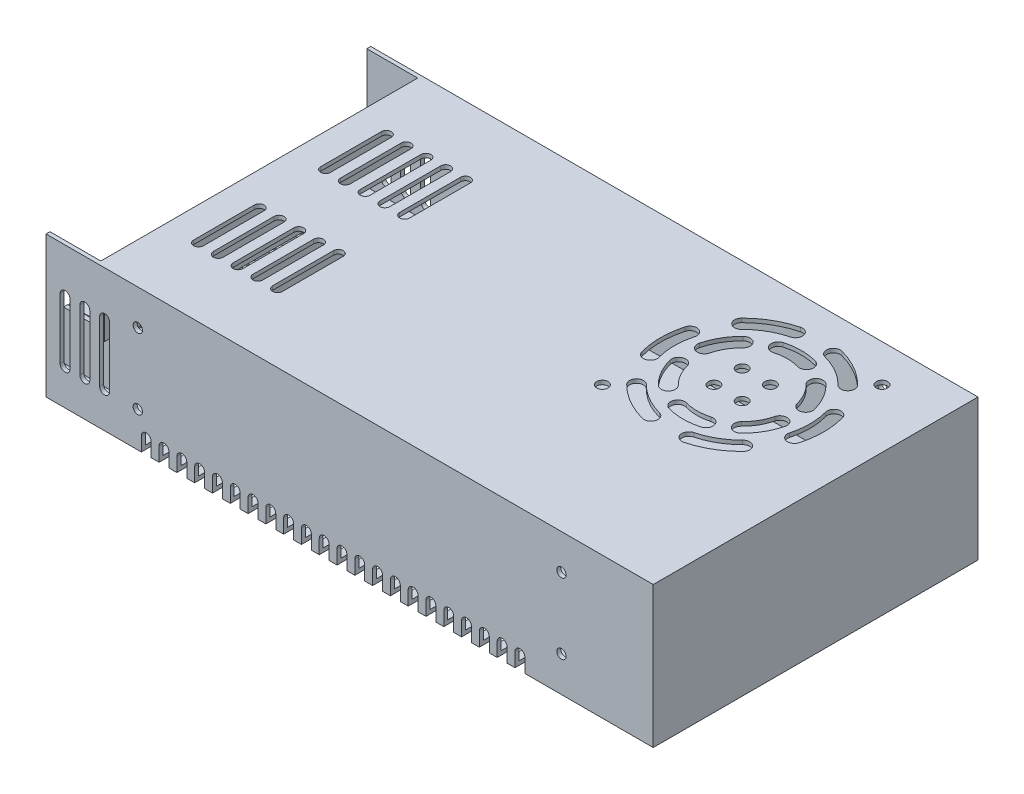
from build123d import *

# Parameters (mm, degrees)
BOSS_EXTRUDE1_DEPTH                  = 50
SKETCH2_W                            = 215
SKETCH2_H                            = 115
BOSS_EXTRUDE2_DEPTH                  = 1.4
SKETCH3_W                            = 197
SKETCH3_H                            = 115
BOSS_EXTRUDE3_DEPTH                  = 1.4
SKETCH4_W                            = 1.4
SKETCH4_H                            = 112.2
BOSS_EXTRUDE4_DEPTH                  = 24
SKETCH16_W                           = 1.4
SKETCH16_H                           = 112.2
BOSS_EXTRUDE5_DEPTH                  = 6
CUT_EXTRUDE1_DEPTH                   = 1.4
CUT_EXTRUDE2_DEPTH                   = 1.4
CUT_EXTRUDE3_START                   = -1.4
CUT_EXTRUDE3_DEPTH                   = 1.4
CUT_EXTRUDE4_DEPTH                   = 1.4
SKETCH15_R                           = 2
CUT_EXTRUDE5_DEPTH                   = 1.4
SKETCH17_W                           = 213.5
SKETCH17_H                           = 112
BOSS_EXTRUDE6_DEPTH                  = 1.6
TAP_START                            = -57.5
TAP_DRILL_FOR_M4X0_7_TAP3_OUTLINE_R  = 1.65
TAP_DRILL_FOR_M4X0_7_TAP3_DEPTH      = 1.4
TAP_START_2                          = 56.1
TAP_DRILL_FOR_M4X0_7_TAP2_OUTLINE_R  = 1.65
TAP_DRILL_FOR_M4X0_7_TAP2_DEPTH      = 1.4
SKETCH20_W                           = 1.25
SKETCH20_H                           = 1.4
TAP_DRILL_FOR_M3X0_5_TAP3_AT_2_COUNT = 2
TAP_DRILL_FOR_M3X0_5_TAP3_AT_2_PITCH = 95
TAP_DRILL_FOR_M3X0_5_TAP3_AT_3_COUNT = 2
TAP_DRILL_FOR_M3X0_5_TAP3_AT_3_PITCH = 177.5
TAP_DRILL_FOR_M3X0_5_TAP3_AT_4_COUNT = 2
TAP_DRILL_FOR_M3X0_5_TAP3_AT_4_PITCH = 201.323744253
SKETCH21_W                           = 1.65
SKETCH21_H                           = 7.7
TAP_DRILL_FOR_M4X0_7_TAP1_AT_2_COUNT = 2
TAP_DRILL_FOR_M4X0_7_TAP1_AT_2_PITCH = 50
TAP_DRILL_FOR_M4X0_7_TAP1_AT_3_COUNT = 2
TAP_DRILL_FOR_M4X0_7_TAP1_AT_3_PITCH = 150
TAP_DRILL_FOR_M4X0_7_TAP1_AT_4_COUNT = 2
TAP_DRILL_FOR_M4X0_7_TAP1_AT_4_PITCH = 158.113883008
SKETCH22_W                           = 17.5
SKETCH22_H                           = 87.3
BOSS_EXTRUDE7_DEPTH                  = 7
BOSS_EXTRUDE8_DEPTH                  = 13.2
BOSS_EXTRUDE9_DEPTH                  = 17.2
SKETCH23_W                           = 7.633333334
SKETCH23_H                           = 7.633333333
SKETCH23_H_2                         = 7.633333334
BOSS_EXTRUDE10_DEPTH                 = 1.2
SKETCH23_3_R                         = 3.25
BOSS_EXTRUDE11_DEPTH                 = 4
FILLET1_R                            = 1
CUT_EXTRUDE7_START                   = 3
CUT_EXTRUDE7_DEPTH                   = 1
SKETCH24_W                           = 17.3
SKETCH24_H                           = 83.9
BOSS_EXTRUDE12_DEPTH                 = 2
SKETCH25_W                           = 1.9
SKETCH25_H                           = 0.25
SKETCH25_W_2                         = 2.7
SKETCH25_W_3                         = 0.4
SKETCH25_H_2                         = 8.5
BOSS_EXTRUDE13_DEPTH                 = 0.01


# Read off the part's stored shape, not the designer's step: Tap Drill for M4x0.7 Tap3, Tap Drill for M4x0.7 Tap2
with BuildPart() as part:
    # Sketch1 → Boss-Extrude1 (new body)
    with BuildSketch(Plane(origin=(0, 0, 0), x_dir=(1, 0, 0), z_dir=(0, 1, 0))):
        Polygon((-107.5, 56.1), (106.1, 56.1), (106.1, -56.1), (-107.5, -56.1), (-107.5, -57.5), (107.5, -57.5), (107.5, 57.5), (-107.5, 57.5), align=None)
    extrude(amount=BOSS_EXTRUDE1_DEPTH)

    # Sketch2 → Boss-Extrude2 (add)
    with BuildSketch(Plane(origin=(0, 0, 0), x_dir=(1, 0, 0), z_dir=(0, 1, 0))):
        Rectangle(SKETCH2_W, SKETCH2_H)
    extrude(amount=BOSS_EXTRUDE2_DEPTH)

    # Sketch3 → Boss-Extrude3 (add)
    with BuildSketch(Plane(origin=(0, 50, 0), x_dir=(1, 0, 0), z_dir=(0, 1, 0))):
        with Locations((9, 0)):
            Rectangle(SKETCH3_W, SKETCH3_H)
    extrude(amount=-BOSS_EXTRUDE3_DEPTH)

    # Sketch4 → Boss-Extrude4 (add)
    with BuildSketch(Plane(origin=(0, 50, 0), x_dir=(1, 0, 0), z_dir=(0, 1, 0))):
        with Locations((-88.8, 0)):
            Rectangle(SKETCH4_W, SKETCH4_H)
    extrude(amount=-BOSS_EXTRUDE4_DEPTH)

    # Sketch16 → Boss-Extrude5 (add)
    with BuildSketch(Plane.XZ):
        with Locations((-106.8, 0)):
            Rectangle(SKETCH16_W, SKETCH16_H)
    extrude(amount=-BOSS_EXTRUDE5_DEPTH)

    # Sketch5 → Cut-Extrude1 (cut)
    with BuildSketch(Plane(origin=(0, 50, 0), x_dir=(1, 0, 0), z_dir=(0, 1, 0))):
        with BuildLine():
            Line((-79.5, -11.75), (-79.5, -33.25))
            ThreePointArc((-79.5, -33.25), (-77.75, -35), (-76, -33.25))
            Line((-76, -33.25), (-76, -11.75))
            ThreePointArc((-76, -11.75), (-77.75, -10), (-79.5, -11.75))
        make_face()
        with BuildLine():
            Line((-72.5, -11.75), (-72.5, -33.25))
            ThreePointArc((-72.5, -33.25), (-70.75, -35), (-69, -33.25))
            Line((-69, -33.25), (-69, -11.75))
            ThreePointArc((-69, -11.75), (-70.75, -10), (-72.5, -11.75))
        make_face()
        with BuildLine():
            Line((-65.5, -11.75), (-65.5, -33.25))
            ThreePointArc((-65.5, -33.25), (-63.75, -35), (-62, -33.25))
            Line((-62, -33.25), (-62, -11.75))
            ThreePointArc((-62, -11.75), (-63.75, -10), (-65.5, -11.75))
        make_face()
        with BuildLine():
            Line((-58.5, -11.75), (-58.5, -33.25))
            ThreePointArc((-58.5, -33.25), (-56.75, -35), (-55, -33.25))
            Line((-55, -33.25), (-55, -11.75))
            ThreePointArc((-55, -11.75), (-56.75, -10), (-58.5, -11.75))
        make_face()
        with BuildLine():
            Line((-51.5, -11.75), (-51.5, -33.25))
            ThreePointArc((-51.5, -33.25), (-49.75, -35), (-48, -33.25))
            Line((-48, -33.25), (-48, -11.75))
            ThreePointArc((-48, -11.75), (-49.75, -10), (-51.5, -11.75))
        make_face()
        with BuildLine():
            Line((-48, 33.25), (-48, 11.75))
            ThreePointArc((-48, 11.75), (-49.75, 10), (-51.5, 11.75))
            Line((-51.5, 11.75), (-51.5, 33.25))
            ThreePointArc((-51.5, 33.25), (-49.75, 35), (-48, 33.25))
        make_face()
        with BuildLine():
            Line((-55, 33.25), (-55, 11.75))
            ThreePointArc((-55, 11.75), (-56.75, 10), (-58.5, 11.75))
            Line((-58.5, 11.75), (-58.5, 33.25))
            ThreePointArc((-58.5, 33.25), (-56.75, 35), (-55, 33.25))
        make_face()
        with BuildLine():
            Line((-62, 33.25), (-62, 11.75))
            ThreePointArc((-62, 11.75), (-63.75, 10), (-65.5, 11.75))
            Line((-65.5, 11.75), (-65.5, 33.25))
            ThreePointArc((-65.5, 33.25), (-63.75, 35), (-62, 33.25))
        make_face()
        with BuildLine():
            Line((-69, 33.25), (-69, 11.75))
            ThreePointArc((-69, 11.75), (-70.75, 10), (-72.5, 11.75))
            Line((-72.5, 11.75), (-72.5, 33.25))
            ThreePointArc((-72.5, 33.25), (-70.75, 35), (-69, 33.25))
        make_face()
        with BuildLine():
            Line((-76, 33.25), (-76, 11.75))
            ThreePointArc((-76, 11.75), (-77.75, 10), (-79.5, 11.75))
            Line((-79.5, 11.75), (-79.5, 33.25))
            ThreePointArc((-79.5, 33.25), (-77.75, 35), (-76, 33.25))
        make_face()
    extrude(amount=-CUT_EXTRUDE1_DEPTH, mode=Mode.SUBTRACT)

    # Sketch6 → Cut-Extrude2 (cut)
    with BuildSketch(Plane(origin=(0, 0, -57.5), x_dir=(-1, 0, 0), z_dir=(0, 0, -1))):
        with BuildLine():
            Line((102.5, 34.25), (102.5, 12.75))
            ThreePointArc((102.5, 12.75), (100.75, 11), (99, 12.75))
            Line((99, 12.75), (99, 34.25))
            ThreePointArc((99, 34.25), (100.75, 36), (102.5, 34.25))
        make_face()
        with BuildLine():
            Line((92, 34.25), (92, 12.75))
            ThreePointArc((92, 12.75), (93.75, 11), (95.5, 12.75))
            Line((95.5, 12.75), (95.5, 34.25))
            ThreePointArc((95.5, 34.25), (93.75, 36), (92, 34.25))
        make_face()
        with BuildLine():
            Line((85, 34.25), (85, 12.75))
            ThreePointArc((85, 12.75), (86.75, 11), (88.5, 12.75))
            Line((88.5, 12.75), (88.5, 34.25))
            ThreePointArc((88.5, 34.25), (86.75, 36), (85, 34.25))
        make_face()
        with BuildLine():
            Line((73.75, 5), (73.75, 0))
            Line((73.75, 0), (70.25, 0))
            Line((70.25, 0), (70.25, 5))
            ThreePointArc((70.25, 5), (72, 6.75), (73.75, 5))
        make_face()
        with BuildLine():
            Line((67.45, 5), (67.45, 0))
            Line((67.45, 0), (63.95, 0))
            Line((63.95, 0), (63.95, 5))
            ThreePointArc((63.95, 5), (65.7, 6.75), (67.45, 5))
        make_face()
        with BuildLine():
            Line((61.15, 5), (61.15, 0))
            Line((61.15, 0), (57.65, 0))
            Line((57.65, 0), (57.65, 5))
            ThreePointArc((57.65, 5), (59.4, 6.75), (61.15, 5))
        make_face()
        with BuildLine():
            Line((54.85, 5), (54.85, 0))
            Line((54.85, 0), (51.35, 0))
            Line((51.35, 0), (51.35, 5))
            ThreePointArc((51.35, 5), (53.1, 6.75), (54.85, 5))
        make_face()
        with BuildLine():
            Line((48.55, 5), (48.55, 0))
            Line((48.55, 0), (45.05, 0))
            Line((45.05, 0), (45.05, 5))
            ThreePointArc((45.05, 5), (46.8, 6.75), (48.55, 5))
        make_face()
        with BuildLine():
            Line((42.25, 5), (42.25, 0))
            Line((42.25, 0), (38.75, 0))
            Line((38.75, 0), (38.75, 5))
            ThreePointArc((38.75, 5), (40.5, 6.75), (42.25, 5))
        make_face()
        with BuildLine():
            Line((35.95, 5), (35.95, 0))
            Line((35.95, 0), (32.45, 0))
            Line((32.45, 0), (32.45, 5))
            ThreePointArc((32.45, 5), (34.2, 6.75), (35.95, 5))
        make_face()
        with BuildLine():
            Line((29.65, 5), (29.65, 0))
            Line((29.65, 0), (26.15, 0))
            Line((26.15, 0), (26.15, 5))
            ThreePointArc((26.15, 5), (27.9, 6.75), (29.65, 5))
        make_face()
        with BuildLine():
            Line((23.35, 5), (23.35, 0))
            Line((23.35, 0), (19.85, 0))
            Line((19.85, 0), (19.85, 5))
            ThreePointArc((19.85, 5), (21.6, 6.75), (23.35, 5))
        make_face()
        with BuildLine():
            Line((17.05, 5), (17.05, 0))
            Line((17.05, 0), (13.55, 0))
            Line((13.55, 0), (13.55, 5))
            ThreePointArc((13.55, 5), (15.3, 6.75), (17.05, 5))
        make_face()
        with BuildLine():
            Line((10.75, 5), (10.75, 0))
            Line((10.75, 0), (7.25, 0))
            Line((7.25, 0), (7.25, 5))
            ThreePointArc((7.25, 5), (9, 6.75), (10.75, 5))
        make_face()
        with BuildLine():
            Line((4.45, 5), (4.45, 0))
            Line((4.45, 0), (0.95, 0))
            Line((0.95, 0), (0.95, 5))
            ThreePointArc((0.95, 5), (2.7, 6.75), (4.45, 5))
        make_face()
        with BuildLine():
            Line((-1.85, 5), (-1.85, 0))
            Line((-1.85, 0), (-5.35, 0))
            Line((-5.35, 0), (-5.35, 5))
            ThreePointArc((-5.35, 5), (-3.6, 6.75), (-1.85, 5))
        make_face()
        with BuildLine():
            Line((-8.15, 5), (-8.15, 0))
            Line((-8.15, 0), (-11.65, 0))
            Line((-11.65, 0), (-11.65, 5))
            ThreePointArc((-11.65, 5), (-9.9, 6.75), (-8.15, 5))
        make_face()
        with BuildLine():
            Line((-14.45, 5), (-14.45, 0))
            Line((-14.45, 0), (-17.95, 0))
            Line((-17.95, 0), (-17.95, 5))
            ThreePointArc((-17.95, 5), (-16.2, 6.75), (-14.45, 5))
        make_face()
        with BuildLine():
            Line((-20.75, 5), (-20.75, 0))
            Line((-20.75, 0), (-24.25, 0))
            Line((-24.25, 0), (-24.25, 5))
            ThreePointArc((-24.25, 5), (-22.5, 6.75), (-20.75, 5))
        make_face()
        with BuildLine():
            Line((-27.05, 5), (-27.05, 0))
            Line((-27.05, 0), (-30.55, 0))
            Line((-30.55, 0), (-30.55, 5))
            ThreePointArc((-30.55, 5), (-28.8, 6.75), (-27.05, 5))
        make_face()
        with BuildLine():
            Line((-33.35, 5), (-33.35, 0))
            Line((-33.35, 0), (-36.85, 0))
            Line((-36.85, 0), (-36.85, 5))
            ThreePointArc((-36.85, 5), (-35.1, 6.75), (-33.35, 5))
        make_face()
        with BuildLine():
            Line((-39.65, 5), (-39.65, 0))
            Line((-39.65, 0), (-43.15, 0))
            Line((-43.15, 0), (-43.15, 5))
            ThreePointArc((-43.15, 5), (-41.4, 6.75), (-39.65, 5))
        make_face()
        with BuildLine():
            Line((-45.95, 5), (-45.95, 0))
            Line((-45.95, 0), (-49.45, 0))
            Line((-49.45, 0), (-49.45, 5))
            ThreePointArc((-49.45, 5), (-47.7, 6.75), (-45.95, 5))
        make_face()
        with BuildLine():
            Line((-52.25, 5), (-52.25, 0))
            Line((-52.25, 0), (-55.75, 0))
            Line((-55.75, 0), (-55.75, 5))
            ThreePointArc((-55.75, 5), (-54, 6.75), (-52.25, 5))
        make_face()
        with BuildLine():
            Line((-58.55, 5), (-58.55, 0))
            Line((-58.55, 0), (-62.05, 0))
            Line((-62.05, 0), (-62.05, 5))
            ThreePointArc((-62.05, 5), (-60.3, 6.75), (-58.55, 5))
        make_face()
    extrude(amount=-CUT_EXTRUDE2_DEPTH, mode=Mode.SUBTRACT)

    # Sketch7 → Cut-Extrude3 (cut)
    with BuildSketch(Plane.XY.offset(57.5).offset(CUT_EXTRUDE3_START)):
        with BuildLine():
            Line((-102.5, 34.25), (-102.5, 12.75))
            ThreePointArc((-102.5, 12.75), (-100.75, 11), (-99, 12.75))
            Line((-99, 12.75), (-99, 34.25))
            ThreePointArc((-99, 34.25), (-100.75, 36), (-102.5, 34.25))
        make_face()
        with BuildLine():
            Line((-73.75, 5), (-73.75, 0))
            Line((-73.75, 0), (-70.25, 0))
            Line((-70.25, 0), (-70.25, 5))
            ThreePointArc((-70.25, 5), (-72, 6.75), (-73.75, 5))
        make_face()
        with BuildLine():
            Line((-85, 12.75), (-85, 34.25))
            ThreePointArc((-85, 34.25), (-86.75, 36), (-88.5, 34.25))
            Line((-88.5, 34.25), (-88.5, 12.75))
            ThreePointArc((-88.5, 12.75), (-86.75, 11), (-85, 12.75))
        make_face()
        with BuildLine():
            Line((-92, 12.75), (-92, 34.25))
            ThreePointArc((-92, 34.25), (-93.75, 36), (-95.5, 34.25))
            Line((-95.5, 34.25), (-95.5, 12.75))
            ThreePointArc((-95.5, 12.75), (-93.75, 11), (-92, 12.75))
        make_face()
        with BuildLine():
            Line((-54.85, 5), (-54.85, 0))
            Line((-54.85, 0), (-51.35, 0))
            Line((-51.35, 0), (-51.35, 5))
            ThreePointArc((-51.35, 5), (-53.1, 6.75), (-54.85, 5))
        make_face()
        with BuildLine():
            Line((-61.15, 5), (-61.15, 0))
            Line((-61.15, 0), (-57.65, 0))
            Line((-57.65, 0), (-57.65, 5))
            ThreePointArc((-57.65, 5), (-59.4, 6.75), (-61.15, 5))
        make_face()
        with BuildLine():
            Line((-63.95, 0), (-63.95, 5))
            ThreePointArc((-63.95, 5), (-65.7, 6.75), (-67.45, 5))
            Line((-67.45, 5), (-67.45, 0))
            Line((-67.45, 0), (-63.95, 0))
        make_face()
        with BuildLine():
            Line((-29.65, 5), (-29.65, 0))
            Line((-29.65, 0), (-26.15, 0))
            Line((-26.15, 0), (-26.15, 5))
            ThreePointArc((-26.15, 5), (-27.9, 6.75), (-29.65, 5))
        make_face()
        with BuildLine():
            Line((-35.95, 5), (-35.95, 0))
            Line((-35.95, 0), (-32.45, 0))
            Line((-32.45, 0), (-32.45, 5))
            ThreePointArc((-32.45, 5), (-34.2, 6.75), (-35.95, 5))
        make_face()
        with BuildLine():
            Line((-42.25, 5), (-42.25, 0))
            Line((-42.25, 0), (-38.75, 0))
            Line((-38.75, 0), (-38.75, 5))
            ThreePointArc((-38.75, 5), (-40.5, 6.75), (-42.25, 5))
        make_face()
        with BuildLine():
            Line((-45.05, 0), (-45.05, 5))
            ThreePointArc((-45.05, 5), (-46.8, 6.75), (-48.55, 5))
            Line((-48.55, 5), (-48.55, 0))
            Line((-48.55, 0), (-45.05, 0))
        make_face()
        with BuildLine():
            Line((-10.75, 5), (-10.75, 0))
            Line((-10.75, 0), (-7.25, 0))
            Line((-7.25, 0), (-7.25, 5))
            ThreePointArc((-7.25, 5), (-9, 6.75), (-10.75, 5))
        make_face()
        with BuildLine():
            Line((-17.05, 5), (-17.05, 0))
            Line((-17.05, 0), (-13.55, 0))
            Line((-13.55, 0), (-13.55, 5))
            ThreePointArc((-13.55, 5), (-15.3, 6.75), (-17.05, 5))
        make_face()
        with BuildLine():
            Line((-23.35, 5), (-23.35, 0))
            Line((-23.35, 0), (-19.85, 0))
            Line((-19.85, 0), (-19.85, 5))
            ThreePointArc((-19.85, 5), (-21.6, 6.75), (-23.35, 5))
        make_face()
        with BuildLine():
            Line((8.15, 5), (8.15, 0))
            Line((8.15, 0), (11.65, 0))
            Line((11.65, 0), (11.65, 5))
            ThreePointArc((11.65, 5), (9.9, 6.75), (8.15, 5))
        make_face()
        with BuildLine():
            Line((1.85, 5), (1.85, 0))
            Line((1.85, 0), (5.35, 0))
            Line((5.35, 0), (5.35, 5))
            ThreePointArc((5.35, 5), (3.6, 6.75), (1.85, 5))
        make_face()
        with BuildLine():
            Line((-4.45, 5), (-4.45, 0))
            Line((-4.45, 0), (-0.95, 0))
            Line((-0.95, 0), (-0.95, 5))
            ThreePointArc((-0.95, 5), (-2.7, 6.75), (-4.45, 5))
        make_face()
        with BuildLine():
            Line((27.05, 5), (27.05, 0))
            Line((27.05, 0), (30.55, 0))
            Line((30.55, 0), (30.55, 5))
            ThreePointArc((30.55, 5), (28.8, 6.75), (27.05, 5))
        make_face()
        with BuildLine():
            Line((20.75, 5), (20.75, 0))
            Line((20.75, 0), (24.25, 0))
            Line((24.25, 0), (24.25, 5))
            ThreePointArc((24.25, 5), (22.5, 6.75), (20.75, 5))
        make_face()
        with BuildLine():
            Line((14.45, 5), (14.45, 0))
            Line((14.45, 0), (17.95, 0))
            Line((17.95, 0), (17.95, 5))
            ThreePointArc((17.95, 5), (16.2, 6.75), (14.45, 5))
        make_face()
        with BuildLine():
            Line((45.95, 5), (45.95, 0))
            Line((45.95, 0), (49.45, 0))
            Line((49.45, 0), (49.45, 5))
            ThreePointArc((49.45, 5), (47.7, 6.75), (45.95, 5))
        make_face()
        with BuildLine():
            Line((39.65, 5), (39.65, 0))
            Line((39.65, 0), (43.15, 0))
            Line((43.15, 0), (43.15, 5))
            ThreePointArc((43.15, 5), (41.4, 6.75), (39.65, 5))
        make_face()
        with BuildLine():
            Line((36.85, 0), (36.85, 5))
            ThreePointArc((36.85, 5), (35.1, 6.75), (33.35, 5))
            Line((33.35, 5), (33.35, 0))
            Line((33.35, 0), (36.85, 0))
        make_face()
        with BuildLine():
            Line((58.55, 5), (58.55, 0))
            Line((58.55, 0), (62.05, 0))
            Line((62.05, 0), (62.05, 5))
            ThreePointArc((62.05, 5), (60.3, 6.75), (58.55, 5))
        make_face()
        with BuildLine():
            Line((55.75, 0), (55.75, 5))
            ThreePointArc((55.75, 5), (54, 6.75), (52.25, 5))
            Line((52.25, 5), (52.25, 0))
            Line((52.25, 0), (55.75, 0))
        make_face()
    extrude(amount=CUT_EXTRUDE3_DEPTH, mode=Mode.SUBTRACT)

    # Sketch14 → Cut-Extrude4 (cut)
    with BuildSketch(Plane.XZ):
        with BuildLine():
            Line((-73.75, -56.1), (-73.75, -37.85))
            ThreePointArc((-73.75, -37.85), (-72, -36.1), (-70.25, -37.85))
            Line((-70.25, -37.85), (-70.25, -56.1))
            Line((-70.25, -56.1), (-73.75, -56.1))
        make_face()
        with BuildLine():
            Line((-67.45, -56.1), (-67.45, -37.85))
            ThreePointArc((-67.45, -37.85), (-65.7, -36.1), (-63.95, -37.85))
            Line((-63.95, -37.85), (-63.95, -56.1))
            Line((-63.95, -56.1), (-67.45, -56.1))
        make_face()
        with BuildLine():
            Line((-61.15, -56.1), (-61.15, -37.85))
            ThreePointArc((-61.15, -37.85), (-59.4, -36.1), (-57.65, -37.85))
            Line((-57.65, -37.85), (-57.65, -56.1))
            Line((-57.65, -56.1), (-61.15, -56.1))
        make_face()
        with BuildLine():
            Line((-54.85, -56.1), (-54.85, -37.85))
            ThreePointArc((-54.85, -37.85), (-53.1, -36.1), (-51.35, -37.85))
            Line((-51.35, -37.85), (-51.35, -56.1))
            Line((-51.35, -56.1), (-54.85, -56.1))
        make_face()
        with BuildLine():
            Line((-48.55, -56.1), (-48.55, -37.85))
            ThreePointArc((-48.55, -37.85), (-46.8, -36.1), (-45.05, -37.85))
            Line((-45.05, -37.85), (-45.05, -56.1))
            Line((-45.05, -56.1), (-48.55, -56.1))
        make_face()
        with BuildLine():
            Line((-42.25, -56.1), (-42.25, -37.85))
            ThreePointArc((-42.25, -37.85), (-40.5, -36.1), (-38.75, -37.85))
            Line((-38.75, -37.85), (-38.75, -56.1))
            Line((-38.75, -56.1), (-42.25, -56.1))
        make_face()
        with BuildLine():
            Line((-35.95, -56.1), (-35.95, -37.85))
            ThreePointArc((-35.95, -37.85), (-34.2, -36.1), (-32.45, -37.85))
            Line((-32.45, -37.85), (-32.45, -56.1))
            Line((-32.45, -56.1), (-35.95, -56.1))
        make_face()
        with BuildLine():
            Line((-29.65, -56.1), (-29.65, -37.85))
            ThreePointArc((-29.65, -37.85), (-27.9, -36.1), (-26.15, -37.85))
            Line((-26.15, -37.85), (-26.15, -56.1))
            Line((-26.15, -56.1), (-29.65, -56.1))
        make_face()
        with BuildLine():
            Line((-23.35, -56.1), (-23.35, -37.85))
            ThreePointArc((-23.35, -37.85), (-21.6, -36.1), (-19.85, -37.85))
            Line((-19.85, -37.85), (-19.85, -56.1))
            Line((-19.85, -56.1), (-23.35, -56.1))
        make_face()
        with BuildLine():
            Line((-17.05, -56.1), (-17.05, -37.85))
            ThreePointArc((-17.05, -37.85), (-15.3, -36.1), (-13.55, -37.85))
            Line((-13.55, -37.85), (-13.55, -56.1))
            Line((-13.55, -56.1), (-17.05, -56.1))
        make_face()
        with BuildLine():
            Line((-10.75, -56.1), (-10.75, -37.85))
            ThreePointArc((-10.75, -37.85), (-9, -36.1), (-7.25, -37.85))
            Line((-7.25, -37.85), (-7.25, -56.1))
            Line((-7.25, -56.1), (-10.75, -56.1))
        make_face()
        with BuildLine():
            Line((-4.45, -56.1), (-4.45, -37.85))
            ThreePointArc((-4.45, -37.85), (-2.7, -36.1), (-0.95, -37.85))
            Line((-0.95, -37.85), (-0.95, -56.1))
            Line((-0.95, -56.1), (-4.45, -56.1))
        make_face()
        with BuildLine():
            Line((1.85, -56.1), (1.85, -37.85))
            ThreePointArc((1.85, -37.85), (3.6, -36.1), (5.35, -37.85))
            Line((5.35, -37.85), (5.35, -56.1))
            Line((5.35, -56.1), (1.85, -56.1))
        make_face()
        with BuildLine():
            Line((8.15, -56.1), (8.15, -37.85))
            ThreePointArc((8.15, -37.85), (9.9, -36.1), (11.65, -37.85))
            Line((11.65, -37.85), (11.65, -56.1))
            Line((11.65, -56.1), (8.15, -56.1))
        make_face()
        with BuildLine():
            Line((14.45, -56.1), (14.45, -37.85))
            ThreePointArc((14.45, -37.85), (16.2, -36.1), (17.95, -37.85))
            Line((17.95, -37.85), (17.95, -56.1))
            Line((17.95, -56.1), (14.45, -56.1))
        make_face()
        with BuildLine():
            Line((20.75, -56.1), (20.75, -37.85))
            ThreePointArc((20.75, -37.85), (22.5, -36.1), (24.25, -37.85))
            Line((24.25, -37.85), (24.25, -56.1))
            Line((24.25, -56.1), (20.75, -56.1))
        make_face()
        with BuildLine():
            Line((27.05, -56.1), (27.05, -37.85))
            ThreePointArc((27.05, -37.85), (28.8, -36.1), (30.55, -37.85))
            Line((30.55, -37.85), (30.55, -56.1))
            Line((30.55, -56.1), (27.05, -56.1))
        make_face()
        with BuildLine():
            Line((33.35, -56.1), (33.35, -37.85))
            ThreePointArc((33.35, -37.85), (35.1, -36.1), (36.85, -37.85))
            Line((36.85, -37.85), (36.85, -56.1))
            Line((36.85, -56.1), (33.35, -56.1))
        make_face()
        with BuildLine():
            Line((39.65, -56.1), (39.65, -37.85))
            ThreePointArc((39.65, -37.85), (41.4, -36.1), (43.15, -37.85))
            Line((43.15, -37.85), (43.15, -56.1))
            Line((43.15, -56.1), (39.65, -56.1))
        make_face()
        with BuildLine():
            Line((45.95, -56.1), (45.95, -37.85))
            ThreePointArc((45.95, -37.85), (47.7, -36.1), (49.45, -37.85))
            Line((49.45, -37.85), (49.45, -56.1))
            Line((49.45, -56.1), (45.95, -56.1))
        make_face()
        with BuildLine():
            Line((52.25, -56.1), (52.25, -37.85))
            ThreePointArc((52.25, -37.85), (54, -36.1), (55.75, -37.85))
            Line((55.75, -37.85), (55.75, -56.1))
            Line((55.75, -56.1), (52.25, -56.1))
        make_face()
        with BuildLine():
            Line((58.55, -56.1), (58.55, -37.85))
            ThreePointArc((58.55, -37.85), (60.3, -36.1), (62.05, -37.85))
            Line((62.05, -37.85), (62.05, -56.1))
            Line((62.05, -56.1), (58.55, -56.1))
        make_face()
        with BuildLine():
            Line((58.55, 56.1), (62.05, 56.1))
            Line((62.05, 56.1), (62.05, 37.85))
            ThreePointArc((62.05, 37.85), (60.3, 36.1), (58.55, 37.85))
            Line((58.55, 37.85), (58.55, 56.1))
        make_face()
        with BuildLine():
            Line((52.25, 56.1), (55.75, 56.1))
            Line((55.75, 56.1), (55.75, 37.85))
            ThreePointArc((55.75, 37.85), (54, 36.1), (52.25, 37.85))
            Line((52.25, 37.85), (52.25, 56.1))
        make_face()
        with BuildLine():
            Line((45.95, 56.1), (49.45, 56.1))
            Line((49.45, 56.1), (49.45, 37.85))
            ThreePointArc((49.45, 37.85), (47.7, 36.1), (45.95, 37.85))
            Line((45.95, 37.85), (45.95, 56.1))
        make_face()
        with BuildLine():
            Line((39.65, 56.1), (43.15, 56.1))
            Line((43.15, 56.1), (43.15, 37.85))
            ThreePointArc((43.15, 37.85), (41.4, 36.1), (39.65, 37.85))
            Line((39.65, 37.85), (39.65, 56.1))
        make_face()
        with BuildLine():
            Line((33.35, 56.1), (36.85, 56.1))
            Line((36.85, 56.1), (36.85, 37.85))
            ThreePointArc((36.85, 37.85), (35.1, 36.1), (33.35, 37.85))
            Line((33.35, 37.85), (33.35, 56.1))
        make_face()
        with BuildLine():
            Line((27.05, 56.1), (30.55, 56.1))
            Line((30.55, 56.1), (30.55, 37.85))
            ThreePointArc((30.55, 37.85), (28.8, 36.1), (27.05, 37.85))
            Line((27.05, 37.85), (27.05, 56.1))
        make_face()
        with BuildLine():
            Line((20.75, 56.1), (24.25, 56.1))
            Line((24.25, 56.1), (24.25, 37.85))
            ThreePointArc((24.25, 37.85), (22.5, 36.1), (20.75, 37.85))
            Line((20.75, 37.85), (20.75, 56.1))
        make_face()
        with BuildLine():
            Line((14.45, 56.1), (17.95, 56.1))
            Line((17.95, 56.1), (17.95, 37.85))
            ThreePointArc((17.95, 37.85), (16.2, 36.1), (14.45, 37.85))
            Line((14.45, 37.85), (14.45, 56.1))
        make_face()
        with BuildLine():
            Line((8.15, 56.1), (11.65, 56.1))
            Line((11.65, 56.1), (11.65, 37.85))
            ThreePointArc((11.65, 37.85), (9.9, 36.1), (8.15, 37.85))
            Line((8.15, 37.85), (8.15, 56.1))
        make_face()
        with BuildLine():
            Line((1.85, 56.1), (5.35, 56.1))
            Line((5.35, 56.1), (5.35, 37.85))
            ThreePointArc((5.35, 37.85), (3.6, 36.1), (1.85, 37.85))
            Line((1.85, 37.85), (1.85, 56.1))
        make_face()
        with BuildLine():
            Line((-4.45, 56.1), (-0.95, 56.1))
            Line((-0.95, 56.1), (-0.95, 37.85))
            ThreePointArc((-0.95, 37.85), (-2.7, 36.1), (-4.45, 37.85))
            Line((-4.45, 37.85), (-4.45, 56.1))
        make_face()
        with BuildLine():
            Line((-10.75, 56.1), (-7.25, 56.1))
            Line((-7.25, 56.1), (-7.25, 37.85))
            ThreePointArc((-7.25, 37.85), (-9, 36.1), (-10.75, 37.85))
            Line((-10.75, 37.85), (-10.75, 56.1))
        make_face()
        with BuildLine():
            Line((-17.05, 56.1), (-13.55, 56.1))
            Line((-13.55, 56.1), (-13.55, 37.85))
            ThreePointArc((-13.55, 37.85), (-15.3, 36.1), (-17.05, 37.85))
            Line((-17.05, 37.85), (-17.05, 56.1))
        make_face()
        with BuildLine():
            Line((-23.35, 56.1), (-19.85, 56.1))
            Line((-19.85, 56.1), (-19.85, 37.85))
            ThreePointArc((-19.85, 37.85), (-21.6, 36.1), (-23.35, 37.85))
            Line((-23.35, 37.85), (-23.35, 56.1))
        make_face()
        with BuildLine():
            Line((-29.65, 56.1), (-26.15, 56.1))
            Line((-26.15, 56.1), (-26.15, 37.85))
            ThreePointArc((-26.15, 37.85), (-27.9, 36.1), (-29.65, 37.85))
            Line((-29.65, 37.85), (-29.65, 56.1))
        make_face()
        with BuildLine():
            Line((-35.95, 56.1), (-32.45, 56.1))
            Line((-32.45, 56.1), (-32.45, 37.85))
            ThreePointArc((-32.45, 37.85), (-34.2, 36.1), (-35.95, 37.85))
            Line((-35.95, 37.85), (-35.95, 56.1))
        make_face()
        with BuildLine():
            Line((-42.25, 56.1), (-38.75, 56.1))
            Line((-38.75, 56.1), (-38.75, 37.85))
            ThreePointArc((-38.75, 37.85), (-40.5, 36.1), (-42.25, 37.85))
            Line((-42.25, 37.85), (-42.25, 56.1))
        make_face()
        with BuildLine():
            Line((-48.55, 56.1), (-45.05, 56.1))
            Line((-45.05, 56.1), (-45.05, 37.85))
            ThreePointArc((-45.05, 37.85), (-46.8, 36.1), (-48.55, 37.85))
            Line((-48.55, 37.85), (-48.55, 56.1))
        make_face()
        with BuildLine():
            Line((-54.85, 56.1), (-51.35, 56.1))
            Line((-51.35, 56.1), (-51.35, 37.85))
            ThreePointArc((-51.35, 37.85), (-53.1, 36.1), (-54.85, 37.85))
            Line((-54.85, 37.85), (-54.85, 56.1))
        make_face()
        with BuildLine():
            Line((-61.15, 56.1), (-57.65, 56.1))
            Line((-57.65, 56.1), (-57.65, 37.85))
            ThreePointArc((-57.65, 37.85), (-59.4, 36.1), (-61.15, 37.85))
            Line((-61.15, 37.85), (-61.15, 56.1))
        make_face()
        with BuildLine():
            Line((-67.45, 56.1), (-63.95, 56.1))
            Line((-63.95, 56.1), (-63.95, 37.85))
            ThreePointArc((-63.95, 37.85), (-65.7, 36.1), (-67.45, 37.85))
            Line((-67.45, 37.85), (-67.45, 56.1))
        make_face()
        with BuildLine():
            Line((-70.25, 37.85), (-70.25, 56.1))
            Line((-70.25, 56.1), (-73.75, 56.1))
            Line((-73.75, 56.1), (-73.75, 37.85))
            ThreePointArc((-73.75, 37.85), (-72, 36.1), (-70.25, 37.85))
        make_face()
    extrude(amount=-CUT_EXTRUDE4_DEPTH, mode=Mode.SUBTRACT)

    # Sketch15 → Cut-Extrude5 (cut)
    with BuildSketch(Plane(origin=(0, 50, 0), x_dir=(1, 0, 0), z_dir=(0, 1, 0))):
        with Locations(Location((67, 14.5, 0), (0, 0, 270))):
            Circle(SKETCH15_R)
        with Locations(Location((57, 14.5, 0), (0, 0, 270))):
            Circle(SKETCH15_R)
        with Locations(Location((57, 24.5, 0), (0, 0, 270))):
            Circle(SKETCH15_R)
        with Locations(Location((67, 24.5, 0), (0, 0, 270))):
            Circle(SKETCH15_R)
        with Locations(Location((86.748737342, 44.248737342, 0), (0, 0, 270))):
            Circle(SKETCH15_R)
        with Locations(Location((37.251262658, -5.248737342, 0), (0, 0, 270))):
            Circle(SKETCH15_R)
        with BuildLine():
            ThreePointArc((89.884615135, 11.849806293), (90.915, 19.5), (89.884615135, 27.150193707))
            ThreePointArc((89.884615135, 27.150193707), (86.864494342, 28.869927086), (85.144760963, 25.849806293))
            ThreePointArc((85.144760963, 25.849806293), (86, 19.5), (85.144760963, 13.150193707))
            ThreePointArc((85.144760963, 13.150193707), (86.864494342, 10.130072914), (89.884615135, 11.849806293))
        make_face()
        with BuildLine():
            ThreePointArc((67.675675676, 39.718474364), (62, 40.5), (56.324324324, 39.718474364))
            ThreePointArc((56.324324324, 39.718474364), (54.593038766, 36.635837455), (57.675675676, 34.904551897))
            ThreePointArc((57.675675676, 34.904551897), (62, 35.5), (66.324324324, 34.904551897))
            ThreePointArc((66.324324324, 34.904551897), (69.406961234, 36.635837455), (67.675675676, 39.718474364))
        make_face()
        with BuildLine():
            ThreePointArc((68.073286923, -3.718854105), (66.317652283, -6.718247296), (69.317045474, -8.473881935))
            ThreePointArc((69.317045474, -8.473881935), (76.4575, -5.54112455), (82.567569662, -0.823688229))
            ThreePointArc((82.567569662, -0.823688229), (82.546842059, 2.65167979), (79.071474041, 2.630952188))
            ThreePointArc((79.071474041, 2.630952188), (74, -1.284609691), (68.073286923, -3.718854105))
        make_face()
        with BuildLine():
            ThreePointArc((44.928525959, 2.630952188), (41.453157941, 2.65167979), (41.432430338, -0.823688229))
            ThreePointArc((41.432430338, -0.823688229), (47.5425, -5.54112455), (54.682954526, -8.473881935))
            ThreePointArc((54.682954526, -8.473881935), (57.682347717, -6.718247296), (55.926713077, -3.718854105))
            ThreePointArc((55.926713077, -3.718854105), (50, -1.284609691), (44.928525959, 2.630952188))
        make_face()
        with BuildLine():
            ThreePointArc((38.855239037, 25.849806293), (37.135505658, 28.869927086), (34.115384865, 27.150193707))
            ThreePointArc((34.115384865, 27.150193707), (33.085, 19.5), (34.115384865, 11.849806293))
            ThreePointArc((34.115384865, 11.849806293), (37.135505658, 10.130072914), (38.855239037, 13.150193707))
            ThreePointArc((38.855239037, 13.150193707), (38, 19.5), (38.855239037, 25.849806293))
        make_face()
        with BuildLine():
            ThreePointArc((55.926713077, 42.718854105), (57.682347717, 45.718247296), (54.682954526, 47.473881935))
            ThreePointArc((54.682954526, 47.473881935), (47.5425, 44.54112455), (41.432430338, 39.823688229))
            ThreePointArc((41.432430338, 39.823688229), (41.453157941, 36.34832021), (44.928525959, 36.369047812))
            ThreePointArc((44.928525959, 36.369047812), (50, 40.284609691), (55.926713077, 42.718854105))
        make_face()
        with BuildLine():
            ThreePointArc((79.071474041, 36.369047812), (82.546842059, 36.34832021), (82.567569662, 39.823688229))
            ThreePointArc((82.567569662, 39.823688229), (76.4575, 44.54112455), (69.317045474, 47.473881935))
            ThreePointArc((69.317045474, 47.473881935), (66.317652283, 45.718247296), (68.073286923, 42.718854105))
            ThreePointArc((68.073286923, 42.718854105), (74, 40.284609691), (79.071474041, 36.369047812))
        make_face()
        with BuildLine():
            ThreePointArc((73.178571114, 30.947250667), (73.136589934, 34.482535321), (76.671874588, 34.524516501))
            ThreePointArc((76.671874588, 34.524516501), (80.186533479, 30), (82.347550263, 24.693957863))
            ThreePointArc((82.347550263, 24.693957863), (80.543551168, 21.653302134), (77.502895439, 23.457301229))
            ThreePointArc((77.502895439, 23.457301229), (75.856406461, 27.5), (73.178571114, 30.947250667))
        make_face()
        with BuildLine():
            ThreePointArc((77.502895439, 15.542698771), (80.543551168, 17.346697866), (82.347550263, 14.306042137))
            ThreePointArc((82.347550263, 14.306042137), (80.186533479, 9), (76.671874588, 4.475483499))
            ThreePointArc((76.671874588, 4.475483499), (73.136589934, 4.517464679), (73.178571114, 8.052749333))
            ThreePointArc((73.178571114, 8.052749333), (75.856406461, 11.5), (77.502895439, 15.542698771))
        make_face()
        with BuildLine():
            ThreePointArc((66.324324324, 4.095448103), (69.406961234, 2.364162545), (67.675675676, -0.718474364))
            ThreePointArc((67.675675676, -0.718474364), (62, -1.5), (56.324324324, -0.718474364))
            ThreePointArc((56.324324324, -0.718474364), (54.593038766, 2.364162545), (57.675675676, 4.095448103))
            ThreePointArc((57.675675676, 4.095448103), (62, 3.5), (66.324324324, 4.095448103))
        make_face()
        with BuildLine():
            ThreePointArc((50.821428886, 8.052749333), (50.863410066, 4.517464679), (47.328125412, 4.475483499))
            ThreePointArc((47.328125412, 4.475483499), (43.813466521, 9), (41.652449737, 14.306042137))
            ThreePointArc((41.652449737, 14.306042137), (43.456448832, 17.346697866), (46.497104561, 15.542698771))
            ThreePointArc((46.497104561, 15.542698771), (48.143593539, 11.5), (50.821428886, 8.052749333))
        make_face()
        with BuildLine():
            ThreePointArc((46.497104561, 23.457301229), (43.456448832, 21.653302134), (41.652449737, 24.693957863))
            ThreePointArc((41.652449737, 24.693957863), (43.813466521, 30), (47.328125412, 34.524516501))
            ThreePointArc((47.328125412, 34.524516501), (50.863410066, 34.482535321), (50.821428886, 30.947250667))
            ThreePointArc((50.821428886, 30.947250667), (48.143593539, 27.5), (46.497104561, 23.457301229))
        make_face()
    extrude(amount=-CUT_EXTRUDE5_DEPTH, mode=Mode.SUBTRACT)

    # Tap Drill for M4x0.7 Tap3 outline → Tap Drill for M4x0.7 Tap3 (cut)
    with BuildSketch(Plane.XY.offset(TAP_START)):
        with Locations((75, 12.5)):
            Circle(TAP_DRILL_FOR_M4X0_7_TAP3_OUTLINE_R)
        with Locations((-75, 12.5)):
            Circle(TAP_DRILL_FOR_M4X0_7_TAP3_OUTLINE_R)
        with Locations((-75, 37.5)):
            Circle(TAP_DRILL_FOR_M4X0_7_TAP3_OUTLINE_R)
        with Locations((75, 37.5)):
            Circle(TAP_DRILL_FOR_M4X0_7_TAP3_OUTLINE_R)
    extrude(amount=TAP_DRILL_FOR_M4X0_7_TAP3_DEPTH, mode=Mode.SUBTRACT)

    # Tap Drill for M4x0.7 Tap2 outline → Tap Drill for M4x0.7 Tap2 (cut)
    with BuildSketch(Plane.XY.offset(TAP_START_2)):
        with Locations((75, 12.5)):
            Circle(TAP_DRILL_FOR_M4X0_7_TAP2_OUTLINE_R)
        with Locations((-75, 12.5)):
            Circle(TAP_DRILL_FOR_M4X0_7_TAP2_OUTLINE_R)
        with Locations((-75, 37.5)):
            Circle(TAP_DRILL_FOR_M4X0_7_TAP2_OUTLINE_R)
        with Locations((75, 37.5)):
            Circle(TAP_DRILL_FOR_M4X0_7_TAP2_OUTLINE_R)
    extrude(amount=TAP_DRILL_FOR_M4X0_7_TAP2_DEPTH, mode=Mode.SUBTRACT)

    # Sketch20 → Tap Drill for M3x0.5 Tap3 (revolve, cut)
    with BuildSketch(Plane(origin=(97.5, 0, 47.5), x_dir=(0, 0, -1), z_dir=(1, 0, 0))):
        with Locations((0.625, 0.7)):
            Rectangle(SKETCH20_W, SKETCH20_H)
    tap_drill_for_m3x0_5_tap3 = revolve(axis=Axis((97.5, -6.35, 47.5), (0, 1, 0)), mode=Mode.SUBTRACT)

    # Tap Drill for M3x0.5 Tap3 at 2: Tap Drill for M3x0.5 Tap3 ×2
    with Locations(*[(0, 0, -i * TAP_DRILL_FOR_M3X0_5_TAP3_AT_2_PITCH) for i in range(1, TAP_DRILL_FOR_M3X0_5_TAP3_AT_2_COUNT)]):
        add(tap_drill_for_m3x0_5_tap3, mode=Mode.SUBTRACT)

    # Tap Drill for M3x0.5 Tap3 at 3: Tap Drill for M3x0.5 Tap3 ×2
    with Locations(*[(-i * TAP_DRILL_FOR_M3X0_5_TAP3_AT_3_PITCH, 0, 0) for i in range(1, TAP_DRILL_FOR_M3X0_5_TAP3_AT_3_COUNT)]):
        add(tap_drill_for_m3x0_5_tap3, mode=Mode.SUBTRACT)

    # Tap Drill for M3x0.5 Tap3 at 4: Tap Drill for M3x0.5 Tap3 ×2
    with Locations(*[Vector(-0.8816645083703717, 0, -0.4718767791278045) * (i * TAP_DRILL_FOR_M3X0_5_TAP3_AT_4_PITCH) for i in range(1, TAP_DRILL_FOR_M3X0_5_TAP3_AT_4_COUNT)]):
        add(tap_drill_for_m3x0_5_tap3, mode=Mode.SUBTRACT)

    # Sketch21 → Tap Drill for M4x0.7 Tap1 (revolve, cut)
    with BuildSketch(Plane(origin=(75, 0, 25), x_dir=(0, 0, -1), z_dir=(1, 0, 0))):
        with Locations((0.825, 3.85)):
            Rectangle(SKETCH21_W, SKETCH21_H)
    tap_drill_for_m4x0_7_tap1 = revolve(axis=Axis((75, -6.35, 25), (0, 1, 0)), mode=Mode.SUBTRACT)

    # Tap Drill for M4x0.7 Tap1 at 2: Tap Drill for M4x0.7 Tap1 ×2
    with Locations(*[(0, 0, -i * TAP_DRILL_FOR_M4X0_7_TAP1_AT_2_PITCH) for i in range(1, TAP_DRILL_FOR_M4X0_7_TAP1_AT_2_COUNT)]):
        add(tap_drill_for_m4x0_7_tap1, mode=Mode.SUBTRACT)

    # Tap Drill for M4x0.7 Tap1 at 3: Tap Drill for M4x0.7 Tap1 ×2
    with Locations(*[(-i * TAP_DRILL_FOR_M4X0_7_TAP1_AT_3_PITCH, 0, 0) for i in range(1, TAP_DRILL_FOR_M4X0_7_TAP1_AT_3_COUNT)]):
        add(tap_drill_for_m4x0_7_tap1, mode=Mode.SUBTRACT)

    # Tap Drill for M4x0.7 Tap1 at 4: Tap Drill for M4x0.7 Tap1 ×2
    with Locations(*[Vector(-0.9486832980505139, 0, -0.31622776601683794) * (i * TAP_DRILL_FOR_M4X0_7_TAP1_AT_4_PITCH) for i in range(1, TAP_DRILL_FOR_M4X0_7_TAP1_AT_4_COUNT)]):
        add(tap_drill_for_m4x0_7_tap1, mode=Mode.SUBTRACT)

    # Sketch25 → Boss-Extrude13 (add)
    with BuildSketch(Plane.ZY.offset(89.5)):
        Polygon((45.158333333, 40), (45.158333333, 35.1), (47.808333333, 35.1), (47.808333333, 34.5), (44.558333333, 34.5), (44.558333333, 40), align=None)
        Polygon((35.025, 34.5), (35.025, 40), (35.625, 40), (37.675, 35.853759357), (37.675, 40), (38.275, 40), (38.275, 34.5), (37.675, 34.5), (35.625, 38.646240643), (35.625, 34.5), align=None)
        with Locations((27.116666667, 35.75)):
            Rectangle(SKETCH25_W, SKETCH25_H)
        with Locations((27.116666667, 37)):
            Rectangle(SKETCH25_W_2, SKETCH25_H)
        Polygon((25.366666667, 38.125), (28.866666667, 38.125), (28.866666667, 38.375), (27.241666667, 38.375), (27.241666667, 38.875), (26.991666667, 38.875), (26.991666667, 38.375), (25.366666667, 38.375), align=None)
        with Locations((31.883333333, 37.25)):
            Rectangle(SKETCH25_W_3, SKETCH25_H_2)
        with Locations((41.416666667, 37.25)):
            Rectangle(SKETCH25_W_3, SKETCH25_H_2)
        with Locations((22.35, 37.25)):
            Rectangle(SKETCH25_W_3, SKETCH25_H_2)
        with Locations((-6.25, 37.25)):
            Rectangle(SKETCH25_W_3, SKETCH25_H_2)
    extrude(amount=BOSS_EXTRUDE13_DEPTH)


with BuildPart() as body_2:
    # Sketch17 → Boss-Extrude6 (new body)
    with BuildSketch(Plane(origin=(0, 6.1, 0), x_dir=(1, 0, 0), z_dir=(0, 1, 0))):
        with Locations((-0.75, 0)):
            Rectangle(SKETCH17_W, SKETCH17_H)
    extrude(amount=BOSS_EXTRUDE6_DEPTH)

    # Sketch22 → Boss-Extrude7 (add)
    with BuildSketch(Plane(origin=(0, 7.7, 0), x_dir=(1, 0, 0), z_dir=(0, 1, 0))):
        with Locations((-98.35, -8.05)):
            Rectangle(SKETCH22_W, SKETCH22_H)
    extrude(amount=BOSS_EXTRUDE7_DEPTH)

    # Sketch22<3> → Boss-Extrude8 (add)
    with BuildSketch(Plane(origin=(0, 7.7, 0), x_dir=(1, 0, 0), z_dir=(0, 1, 0))):
        Polygon((-89.6, -50.2), (-89.6, 34.1), (-91.1, 34.1), (-91.1, 26.066666667), (-107.1, 26.066666667), (-107.1, 24.566666667), (-91.1, 24.566666667), (-91.1, 16.533333333), (-107.1, 16.533333333), (-107.1, 15.033333333), (-91.1, 15.033333333), (-91.1, 7), (-107.1, 7), (-107.1, 5.5), (-91.1, 5.5), (-91.1, -2.533333333), (-107.1, -2.533333333), (-107.1, -4.033333333), (-91.1, -4.033333333), (-91.1, -12.066666667), (-107.1, -12.066666667), (-107.1, -13.566666667), (-91.1, -13.566666667), (-91.1, -21.6), (-107.1, -21.6), (-107.1, -23.1), (-91.1, -23.1), (-91.1, -31.133333333), (-107.1, -31.133333333), (-107.1, -32.633333333), (-91.1, -32.633333333), (-91.1, -40.666666667), (-107.1, -40.666666667), (-107.1, -42.166666667), (-91.1, -42.166666667), (-91.1, -50.2), align=None)
    extrude(amount=BOSS_EXTRUDE8_DEPTH)

    # Sketch22<4> → Boss-Extrude9 (add)
    with BuildSketch(Plane(origin=(0, 7.7, 0), x_dir=(1, 0, 0), z_dir=(0, 1, 0))):
        Polygon((-89.6, 35.6), (-107.1, 35.6), (-107.1, 34.1), (-91.1, 34.1), (-89.6, 34.1), align=None)
        Polygon((-89.6, -51.7), (-89.6, -50.2), (-91.1, -50.2), (-107.1, -50.2), (-107.1, -51.7), align=None)
    extrude(amount=BOSS_EXTRUDE9_DEPTH)

    # Sketch23 → Boss-Extrude10 (add)
    with BuildSketch(Plane(origin=(0, 14.7, 0), x_dir=(1, 0, 0), z_dir=(0, 1, 0))):
        with Locations((-99.1, 30.083333334)):
            Rectangle(SKETCH23_W, SKETCH23_H)
        with Locations((-99.1, 20.55)):
            Rectangle(SKETCH23_W, SKETCH23_H_2)
        with Locations((-99.1, 11.016666667)):
            Rectangle(SKETCH23_W, SKETCH23_H)
        with Locations((-99.1, 1.483333334)):
            Rectangle(SKETCH23_W, SKETCH23_H)
        with Locations((-99.1, -8.05)):
            Rectangle(SKETCH23_W, SKETCH23_H_2)
        with Locations((-99.1, -17.583333334)):
            Rectangle(SKETCH23_W, SKETCH23_H)
        with Locations((-99.1, -27.116666667)):
            Rectangle(SKETCH23_W, SKETCH23_H)
        with Locations((-99.1, -36.65)):
            Rectangle(SKETCH23_W, SKETCH23_H_2)
        with Locations((-99.1, -46.183333334)):
            Rectangle(SKETCH23_W, SKETCH23_H)
    extrude(amount=BOSS_EXTRUDE10_DEPTH)

    # Sketch23<3> → Boss-Extrude11 (add)
    with BuildSketch(Plane(origin=(0, 14.7, 0), x_dir=(1, 0, 0), z_dir=(0, 1, 0))):
        with Locations(Location((-99.1, 30.083333333, 0), (0, 0, 90))):
            Circle(SKETCH23_3_R)
        with Locations(Location((-99.1, 20.55, 0), (0, 0, 90))):
            Circle(SKETCH23_3_R)
        with Locations(Location((-99.1, 11.016666667, 0), (0, 0, 90))):
            Circle(SKETCH23_3_R)
        with Locations(Location((-99.1, 1.483333333, 0), (0, 0, 90))):
            Circle(SKETCH23_3_R)
        with Locations(Location((-99.1, -8.05, 0), (0, 0, 90))):
            Circle(SKETCH23_3_R)
        with Locations(Location((-99.1, -17.583333333, 0), (0, 0, 90))):
            Circle(SKETCH23_3_R)
        with Locations(Location((-99.1, -27.116666667, 0), (0, 0, 90))):
            Circle(SKETCH23_3_R)
        with Locations(Location((-99.1, -36.65, 0), (0, 0, 90))):
            Circle(SKETCH23_3_R)
        with Locations(Location((-99.1, -46.183333333, 0), (0, 0, 90))):
            Circle(SKETCH23_3_R)
    extrude(amount=BOSS_EXTRUDE11_DEPTH)

    # Fillet1
    fillet1_edges = [body_2.edges().sort_by_distance(p)[0] for p in [
        (-99.1, 18.7, -26.833333333),
        (-99.1, 18.7, -17.3),
        (-99.1, 18.7, -7.766666667),
        (-99.1, 18.7, 1.766666667),
        (-99.1, 18.7, 11.3),
        (-99.1, 18.7, 20.833333333),
        (-99.1, 18.7, 30.366666667),
        (-99.1, 18.7, 39.9),
        (-99.1, 18.7, 49.433333333),
    ]]
    fillet(fillet1_edges, radius=FILLET1_R)

    # Sketch23<4> → Cut-Extrude7 (cut)
    with BuildSketch(Plane(origin=(0, 14.7, 0), x_dir=(1, 0, 0), z_dir=(0, 1, 0)).offset(CUT_EXTRUDE7_START)):
        with BuildLine():
            Line((-99.6, 30.583333333), (-102.311308145, 30.583333333))
            ThreePointArc((-102.311308145, 30.583333333), (-102.35, 30.083333333), (-102.311308145, 29.583333333))
            Line((-102.311308145, 29.583333333), (-99.6, 29.583333333))
            Line((-99.6, 29.583333333), (-99.6, 26.872025189))
            ThreePointArc((-99.6, 26.872025189), (-99.1, 26.833333333), (-98.6, 26.872025189))
            Line((-98.6, 26.872025189), (-98.6, 29.583333333))
            Line((-98.6, 29.583333333), (-95.888691855, 29.583333333))
            ThreePointArc((-95.888691855, 29.583333333), (-95.859687402, 29.832585921), (-95.85, 30.083333333))
            ThreePointArc((-95.85, 30.083333333), (-95.859687402, 30.334080746), (-95.888691855, 30.583333333))
            Line((-95.888691855, 30.583333333), (-98.6, 30.583333333))
            Line((-98.6, 30.583333333), (-98.6, 33.294641478))
            ThreePointArc((-98.6, 33.294641478), (-99.1, 33.333333333), (-99.6, 33.294641478))
            Line((-99.6, 33.294641478), (-99.6, 30.583333333))
        make_face()
        with BuildLine():
            Line((-99.6, 21.05), (-102.311308145, 21.05))
            ThreePointArc((-102.311308145, 21.05), (-102.35, 20.55), (-102.311308145, 20.05))
            Line((-102.311308145, 20.05), (-99.6, 20.05))
            Line((-99.6, 20.05), (-99.6, 17.338691855))
            ThreePointArc((-99.6, 17.338691855), (-99.1, 17.3), (-98.6, 17.338691855))
            Line((-98.6, 17.338691855), (-98.6, 20.05))
            Line((-98.6, 20.05), (-95.888691855, 20.05))
            ThreePointArc((-95.888691855, 20.05), (-95.859687402, 20.299252587), (-95.85, 20.55))
            ThreePointArc((-95.85, 20.55), (-95.859687402, 20.800747413), (-95.888691855, 21.05))
            Line((-95.888691855, 21.05), (-98.6, 21.05))
            Line((-98.6, 21.05), (-98.6, 23.761308145))
            ThreePointArc((-98.6, 23.761308145), (-99.1, 23.8), (-99.6, 23.761308145))
            Line((-99.6, 23.761308145), (-99.6, 21.05))
        make_face()
        with BuildLine():
            Line((-99.6, 11.516666667), (-102.311308145, 11.516666667))
            ThreePointArc((-102.311308145, 11.516666667), (-102.35, 11.016666667), (-102.311308145, 10.516666667))
            Line((-102.311308145, 10.516666667), (-99.6, 10.516666667))
            Line((-99.6, 10.516666667), (-99.6, 7.805358522))
            ThreePointArc((-99.6, 7.805358522), (-99.1, 7.766666667), (-98.6, 7.805358522))
            Line((-98.6, 7.805358522), (-98.6, 10.516666667))
            Line((-98.6, 10.516666667), (-95.888691855, 10.516666667))
            ThreePointArc((-95.888691855, 10.516666667), (-95.859687402, 10.765919254), (-95.85, 11.016666667))
            ThreePointArc((-95.85, 11.016666667), (-95.859687402, 11.267414079), (-95.888691855, 11.516666667))
            Line((-95.888691855, 11.516666667), (-98.6, 11.516666667))
            Line((-98.6, 11.516666667), (-98.6, 14.227974811))
            ThreePointArc((-98.6, 14.227974811), (-99.1, 14.266666667), (-99.6, 14.227974811))
            Line((-99.6, 14.227974811), (-99.6, 11.516666667))
        make_face()
        with BuildLine():
            Line((-99.6, 1.983333333), (-102.311308145, 1.983333333))
            ThreePointArc((-102.311308145, 1.983333333), (-102.35, 1.483333333), (-102.311308145, 0.983333333))
            Line((-102.311308145, 0.983333333), (-99.6, 0.983333333))
            Line((-99.6, 0.983333333), (-99.6, -1.727974811))
            ThreePointArc((-99.6, -1.727974811), (-99.1, -1.766666667), (-98.6, -1.727974811))
            Line((-98.6, -1.727974811), (-98.6, 0.983333333))
            Line((-98.6, 0.983333333), (-95.888691855, 0.983333333))
            ThreePointArc((-95.888691855, 0.983333333), (-95.859687402, 1.232585921), (-95.85, 1.483333333))
            ThreePointArc((-95.85, 1.483333333), (-95.859687402, 1.734080746), (-95.888691855, 1.983333333))
            Line((-95.888691855, 1.983333333), (-98.6, 1.983333333))
            Line((-98.6, 1.983333333), (-98.6, 4.694641478))
            ThreePointArc((-98.6, 4.694641478), (-99.1, 4.733333333), (-99.6, 4.694641478))
            Line((-99.6, 4.694641478), (-99.6, 1.983333333))
        make_face()
        with BuildLine():
            Line((-99.6, -7.55), (-102.311308145, -7.55))
            ThreePointArc((-102.311308145, -7.55), (-102.35, -8.05), (-102.311308145, -8.55))
            Line((-102.311308145, -8.55), (-99.6, -8.55))
            Line((-99.6, -8.55), (-99.6, -11.261308145))
            ThreePointArc((-99.6, -11.261308145), (-99.1, -11.3), (-98.6, -11.261308145))
            Line((-98.6, -11.261308145), (-98.6, -8.55))
            Line((-98.6, -8.55), (-95.888691855, -8.55))
            ThreePointArc((-95.888691855, -8.55), (-95.859687402, -8.300747413), (-95.85, -8.05))
            ThreePointArc((-95.85, -8.05), (-95.859687402, -7.799252587), (-95.888691855, -7.55))
            Line((-95.888691855, -7.55), (-98.6, -7.55))
            Line((-98.6, -7.55), (-98.6, -4.838691855))
            ThreePointArc((-98.6, -4.838691855), (-99.1, -4.8), (-99.6, -4.838691855))
            Line((-99.6, -4.838691855), (-99.6, -7.55))
        make_face()
        with BuildLine():
            Line((-99.6, -17.083333333), (-102.311308145, -17.083333333))
            ThreePointArc((-102.311308145, -17.083333333), (-102.35, -17.583333333), (-102.311308145, -18.083333333))
            Line((-102.311308145, -18.083333333), (-99.6, -18.083333333))
            Line((-99.6, -18.083333333), (-99.6, -20.794641478))
            ThreePointArc((-99.6, -20.794641478), (-99.1, -20.833333333), (-98.6, -20.794641478))
            Line((-98.6, -20.794641478), (-98.6, -18.083333333))
            Line((-98.6, -18.083333333), (-95.888691855, -18.083333333))
            ThreePointArc((-95.888691855, -18.083333333), (-95.859687402, -17.834080746), (-95.85, -17.583333333))
            ThreePointArc((-95.85, -17.583333333), (-95.859687402, -17.332585921), (-95.888691855, -17.083333333))
            Line((-95.888691855, -17.083333333), (-98.6, -17.083333333))
            Line((-98.6, -17.083333333), (-98.6, -14.372025189))
            ThreePointArc((-98.6, -14.372025189), (-99.1, -14.333333333), (-99.6, -14.372025189))
            Line((-99.6, -14.372025189), (-99.6, -17.083333333))
        make_face()
        with BuildLine():
            Line((-99.6, -26.616666667), (-102.311308145, -26.616666667))
            ThreePointArc((-102.311308145, -26.616666667), (-102.35, -27.116666667), (-102.311308145, -27.616666667))
            Line((-102.311308145, -27.616666667), (-99.6, -27.616666667))
            Line((-99.6, -27.616666667), (-99.6, -30.327974811))
            ThreePointArc((-99.6, -30.327974811), (-99.1, -30.366666667), (-98.6, -30.327974811))
            Line((-98.6, -30.327974811), (-98.6, -27.616666667))
            Line((-98.6, -27.616666667), (-95.888691855, -27.616666667))
            ThreePointArc((-95.888691855, -27.616666667), (-95.859687402, -27.367414079), (-95.85, -27.116666667))
            ThreePointArc((-95.85, -27.116666667), (-95.859687402, -26.865919254), (-95.888691855, -26.616666667))
            Line((-95.888691855, -26.616666667), (-98.6, -26.616666667))
            Line((-98.6, -26.616666667), (-98.6, -23.905358522))
            ThreePointArc((-98.6, -23.905358522), (-99.1, -23.866666667), (-99.6, -23.905358522))
            Line((-99.6, -23.905358522), (-99.6, -26.616666667))
        make_face()
        with BuildLine():
            Line((-99.6, -36.15), (-102.311308145, -36.15))
            ThreePointArc((-102.311308145, -36.15), (-102.35, -36.65), (-102.311308145, -37.15))
            Line((-102.311308145, -37.15), (-99.6, -37.15))
            Line((-99.6, -37.15), (-99.6, -39.861308145))
            ThreePointArc((-99.6, -39.861308145), (-99.1, -39.9), (-98.6, -39.861308145))
            Line((-98.6, -39.861308145), (-98.6, -37.15))
            Line((-98.6, -37.15), (-95.888691855, -37.15))
            ThreePointArc((-95.888691855, -37.15), (-95.859687402, -36.900747413), (-95.85, -36.65))
            ThreePointArc((-95.85, -36.65), (-95.859687402, -36.399252587), (-95.888691855, -36.15))
            Line((-95.888691855, -36.15), (-98.6, -36.15))
            Line((-98.6, -36.15), (-98.6, -33.438691855))
            ThreePointArc((-98.6, -33.438691855), (-99.1, -33.4), (-99.6, -33.438691855))
            Line((-99.6, -33.438691855), (-99.6, -36.15))
        make_face()
        with BuildLine():
            Line((-99.6, -45.683333333), (-102.311308145, -45.683333333))
            ThreePointArc((-102.311308145, -45.683333333), (-102.35, -46.183333333), (-102.311308145, -46.683333333))
            Line((-102.311308145, -46.683333333), (-99.6, -46.683333333))
            Line((-99.6, -46.683333333), (-99.6, -49.394641478))
            ThreePointArc((-99.6, -49.394641478), (-99.1, -49.433333333), (-98.6, -49.394641478))
            Line((-98.6, -49.394641478), (-98.6, -46.683333333))
            Line((-98.6, -46.683333333), (-95.888691855, -46.683333333))
            ThreePointArc((-95.888691855, -46.683333333), (-95.859687402, -46.434080746), (-95.85, -46.183333333))
            ThreePointArc((-95.85, -46.183333333), (-95.859687402, -45.932585921), (-95.888691855, -45.683333333))
            Line((-95.888691855, -45.683333333), (-98.6, -45.683333333))
            Line((-98.6, -45.683333333), (-98.6, -42.972025189))
            ThreePointArc((-98.6, -42.972025189), (-99.1, -42.933333333), (-99.6, -42.972025189))
            Line((-99.6, -42.972025189), (-99.6, -45.683333333))
        make_face()
    extrude(amount=CUT_EXTRUDE7_DEPTH, mode=Mode.SUBTRACT)


with BuildPart() as body_3:
    # Sketch24 → Boss-Extrude12 (new body)
    with BuildSketch(Plane(origin=(0, 24.9, 0), x_dir=(1, 0, 0), z_dir=(0, 1, 0))):
        with Locations((-98.35, -8.05)):
            Rectangle(SKETCH24_W, SKETCH24_H)
    extrude(amount=-BOSS_EXTRUDE12_DEPTH)


solid = Compound([part.part, body_2.part, body_3.part])
